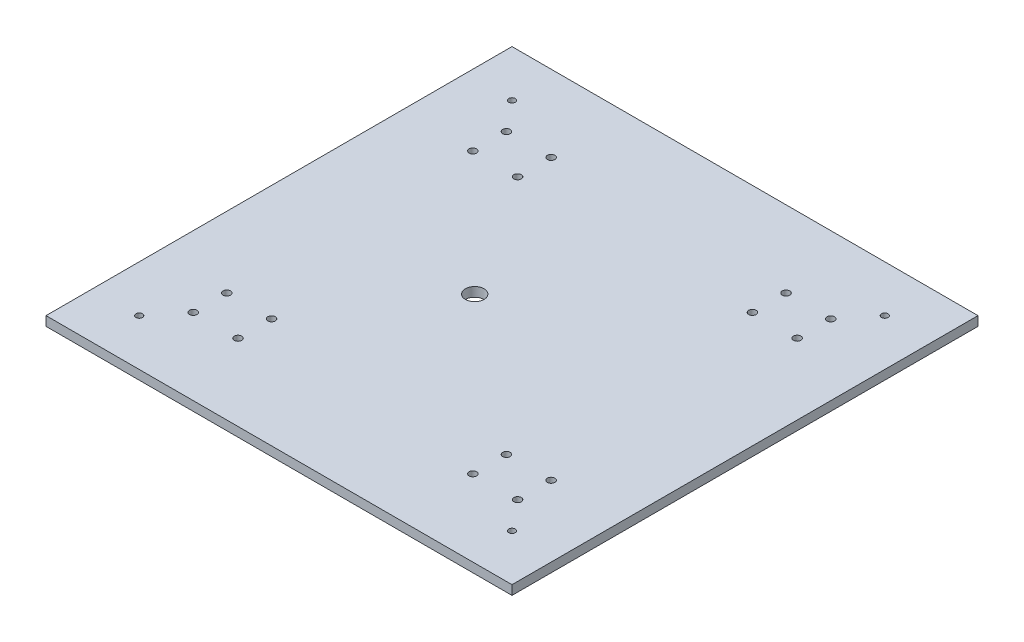
from build123d import *

# Parameters (mm, degrees)
SKETCH1_W           = 250
SKETCH1_H           = 250
SKETCH1_R           = 1.75
SKETCH1_R_2         = 2
SKETCH1_R_3         = 5
BOSS_EXTRUDE1_DEPTH = 5
SKETCH2_W           = 20
SKETCH2_H           = 5
BOSS_EXTRUDE2_DEPTH = 10
BOSS_EXTRUDE7_DEPTH = 20


with BuildPart() as part:
    # Sketch1 → Boss-Extrude1 (new body)
    with BuildSketch(Plane(origin=(0, 0, 0), x_dir=(1, 0, 0), z_dir=(0, 1, 0))):
        Rectangle(SKETCH1_W, SKETCH1_H)
        with Locations((-100, 100)):
            Circle(SKETCH1_R, mode=Mode.SUBTRACT)
        with Locations((100, 100)):
            Circle(SKETCH1_R, mode=Mode.SUBTRACT)
        with Locations((100, -100)):
            Circle(SKETCH1_R, mode=Mode.SUBTRACT)
        with Locations((-100, -100)):
            Circle(SKETCH1_R, mode=Mode.SUBTRACT)
        with Locations((-87, 84)):
            Circle(SKETCH1_R_2, mode=Mode.SUBTRACT)
        with Locations((-87, 66)):
            Circle(SKETCH1_R_2, mode=Mode.SUBTRACT)
        with Locations((-63, 84)):
            Circle(SKETCH1_R_2, mode=Mode.SUBTRACT)
        with Locations((-63, 66)):
            Circle(SKETCH1_R_2, mode=Mode.SUBTRACT)
        with Locations((63, 84)):
            Circle(SKETCH1_R_2, mode=Mode.SUBTRACT)
        with Locations((63, 66)):
            Circle(SKETCH1_R_2, mode=Mode.SUBTRACT)
        with Locations((87, 84)):
            Circle(SKETCH1_R_2, mode=Mode.SUBTRACT)
        with Locations((87, 66)):
            Circle(SKETCH1_R_2, mode=Mode.SUBTRACT)
        with Locations((-87, -66)):
            Circle(SKETCH1_R_2, mode=Mode.SUBTRACT)
        with Locations((-87, -84)):
            Circle(SKETCH1_R_2, mode=Mode.SUBTRACT)
        with Locations((-63, -66)):
            Circle(SKETCH1_R_2, mode=Mode.SUBTRACT)
        with Locations((-63, -84)):
            Circle(SKETCH1_R_2, mode=Mode.SUBTRACT)
        with Locations((63, -66)):
            Circle(SKETCH1_R_2, mode=Mode.SUBTRACT)
        with Locations((63, -84)):
            Circle(SKETCH1_R_2, mode=Mode.SUBTRACT)
        with Locations((87, -66)):
            Circle(SKETCH1_R_2, mode=Mode.SUBTRACT)
        with Locations((87, -84)):
            Circle(SKETCH1_R_2, mode=Mode.SUBTRACT)
        with Locations((-20, 0)):
            Circle(SKETCH1_R_3, mode=Mode.SUBTRACT)
    extrude(amount=BOSS_EXTRUDE1_DEPTH)

    # Sketch2 → Boss-Extrude2 (add)
    with BuildSketch(Plane.XZ):
        with Locations((0, 110)):
            Rectangle(SKETCH2_W, SKETCH2_H)
        with Locations((0, -110)):
            Rectangle(SKETCH2_W, SKETCH2_H)
    extrude(amount=BOSS_EXTRUDE2_DEPTH)

    # Sketch4 → Boss-Extrude7 (add)
    with BuildSketch(Plane.ZY.offset(10)):
        Polygon((112.5, -10), (118.273502692, 0), (112.5, 0), align=None)
    extrude(amount=-BOSS_EXTRUDE7_DEPTH)


solid = part.part
